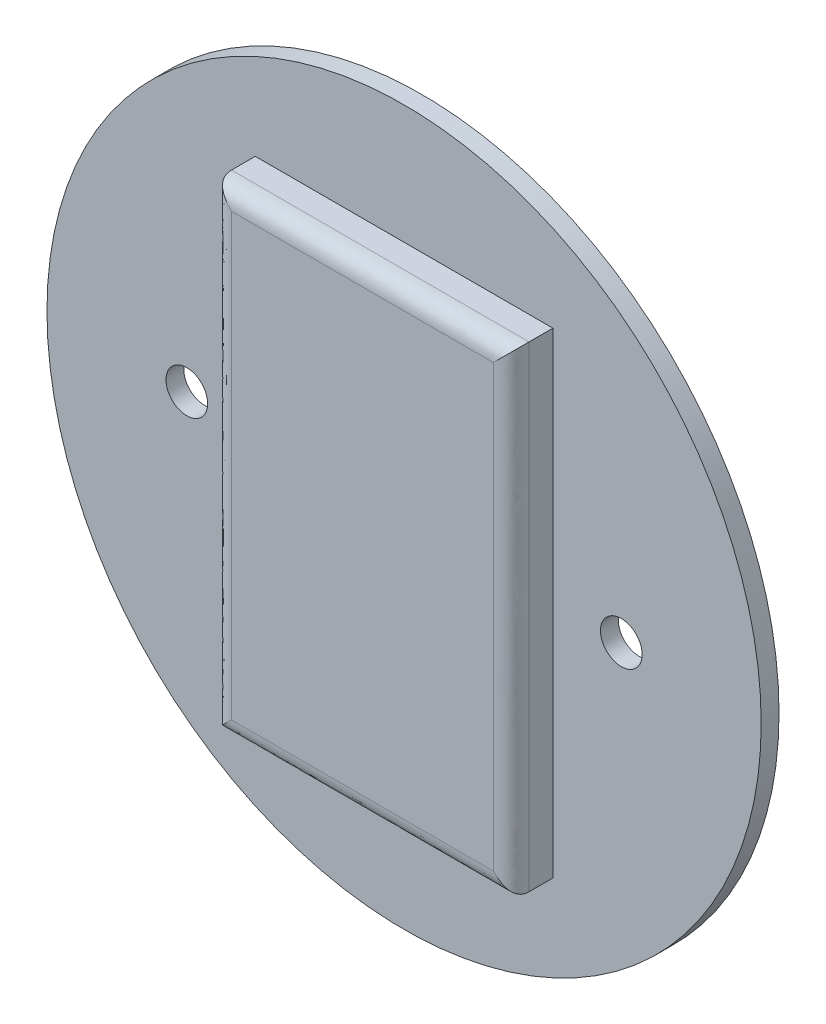
from build123d import *

# Parameters (mm, degrees)
SKETCH_1_R      = 30
SKETCH_1_R_2    = 1.75
SKETCH_1_W      = 25
SKETCH_1_H      = 40
EXTRUDE_6_DEPTH = 1.5
EXTRUDE_7_DEPTH = 5
SKETCH_1_10_R   = 2
SKETCH_1_10_W   = 7
SKETCH_1_10_H   = 7
EXTRUDE_8_DEPTH = 6
FILLET_3_SIZE   = 1.5
FILLET_4_SIZE   = 1.5
EXTRUDE_9_DEPTH = 5
FILLET_5_SIZE   = 1.5


with BuildPart() as part:
    # 草图1 → 凸台-拉伸6 (new body)
    with BuildSketch(Plane.XY):
        Circle(SKETCH_1_R)
        with Locations((18.25, 0)):
            Circle(SKETCH_1_R_2, mode=Mode.SUBTRACT)
        with Locations((-18.25, 0)):
            Circle(SKETCH_1_R_2, mode=Mode.SUBTRACT)
        Rectangle(SKETCH_1_W, SKETCH_1_H, mode=Mode.SUBTRACT)
    extrude(amount=EXTRUDE_6_DEPTH)

    # 草图1<9> → 凸台-拉伸7 (add)
    with BuildSketch(Plane.XY):
        Polygon((-12.5, 20), (-12.5, 0), (0, 0), (12.5, 0), (12.5, 20), align=None)
    extrude(amount=EXTRUDE_7_DEPTH)

    # 草图1<10> → 凸台-拉伸8 (add)
    with BuildSketch(Plane.XY):
        with Locations((8, -24.5)):
            Circle(SKETCH_1_10_R)
        with Locations((0, -24.5)):
            Rectangle(SKETCH_1_10_W, SKETCH_1_10_H)
        with Locations((-8, -24.5)):
            Circle(SKETCH_1_10_R)
    extrude(amount=-EXTRUDE_8_DEPTH)

    # 圆角3
    # a fillet whose section is not a circle: 1.5 mm, written as the material it takes off along each edge
    with BuildSketch(Plane(origin=(8, -24.5, -6), x_dir=(1, 0, 0), z_dir=(0, -1, 0))) as fillet_3_piece_1:
        with BuildLine():
            Bezier((2, FILLET_3_SIZE), (2, 0), (2 - FILLET_3_SIZE, 0), weights=[1, 1, 1])
            Line((2 - FILLET_3_SIZE, 0), (2, 0))
            Line((2, 0), (2, FILLET_3_SIZE))
        make_face()
    revolve(axis=Axis((8, -24.5, -6), (0, 0, 1)), mode=Mode.SUBTRACT)

    # 圆角4
    # a fillet whose section is not a circle: 1.5 mm, written as the material it takes off along each edge
    with BuildSketch(Plane(origin=(-8, -24.5, -6), x_dir=(1, 0, 0), z_dir=(0, -1, 0))) as fillet_4_piece_1:
        with BuildLine():
            Bezier((2, FILLET_4_SIZE), (2, 0), (2 - FILLET_4_SIZE, 0), weights=[1, 1, 1])
            Line((2 - FILLET_4_SIZE, 0), (2, 0))
            Line((2, 0), (2, FILLET_4_SIZE))
        make_face()
    revolve(axis=Axis((-8, -24.5, -6), (0, 0, 1)), mode=Mode.SUBTRACT)

    # 草图1<11> → 凸台-拉伸9 (add)
    with BuildSketch(Plane.XY):
        Polygon((-12.5, 0), (-12.5, -20), (12.5, -20), (12.5, 0), (0, 0), align=None)
    extrude(amount=EXTRUDE_9_DEPTH)

    # 圆角5
    # a fillet whose section is not a circle: 1.5 mm, written as the material it takes off along each edge
    with BuildSketch(Plane(origin=(16.25, 20, 5), x_dir=(0, -1, 0), z_dir=(-1, 0, 0))) as fillet_5_piece_1:
        with BuildLine():
            Bezier((FILLET_5_SIZE, 0), (0, 0), (0, -FILLET_5_SIZE), weights=[1, 1, 1])
            Line((0, -FILLET_5_SIZE), (0, 0))
            Line((0, 0), (FILLET_5_SIZE, 0))
        make_face()
    extrude(amount=32.5, mode=Mode.SUBTRACT)
    with BuildSketch(Plane(origin=(12.5, 23.75, 5), x_dir=(-1, 0, 0), z_dir=(0, -1, 0)), Plane(origin=(-12.5, -23.75, 5), x_dir=(1, 0, 0), z_dir=(0, 1, 0))) as fillet_5_piece_2:
        with BuildLine():
            Bezier((FILLET_5_SIZE, 0), (0, 0), (0, FILLET_5_SIZE), weights=[1, 1, 1])
            Line((0, FILLET_5_SIZE), (0, 0))
            Line((0, 0), (FILLET_5_SIZE, 0))
        make_face()
    extrude(amount=47.5, mode=Mode.SUBTRACT)
    with BuildSketch(Plane(origin=(-16.25, -20, 5), x_dir=(0, 0, -1), z_dir=(1, 0, 0))) as fillet_5_piece_3:
        with BuildLine():
            Bezier((FILLET_5_SIZE, 0), (0, 0), (0, FILLET_5_SIZE), weights=[1, 1, 1])
            Line((0, FILLET_5_SIZE), (0, 0))
            Line((0, 0), (FILLET_5_SIZE, 0))
        make_face()
    extrude(amount=32.5, mode=Mode.SUBTRACT)


solid = part.part
